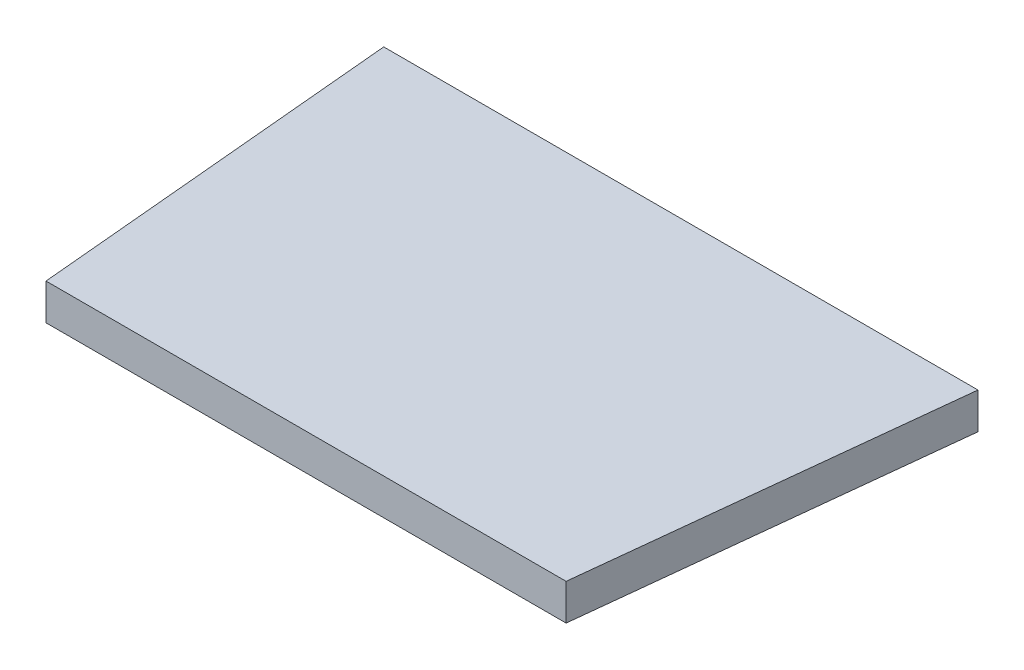
from build123d import *

# Parameters (mm, degrees)
BOSS_EXTRUDE1_DEPTH = 5


with BuildPart() as part:
    # Sketch2 → Boss-Extrude1 (new body)
    with BuildSketch(Plane(origin=(0, 0, 0), x_dir=(1, 0, 0), z_dir=(0, 1, 0))):
        Polygon((47.461035906, 35.607068868), (-34.652651446, 35.607068868), (-29.968520727, -15.743793477), (9.111308324, -15.743793477), (41.897868045, -15.743793477), align=None)
    extrude(amount=BOSS_EXTRUDE1_DEPTH)


solid = part.part
